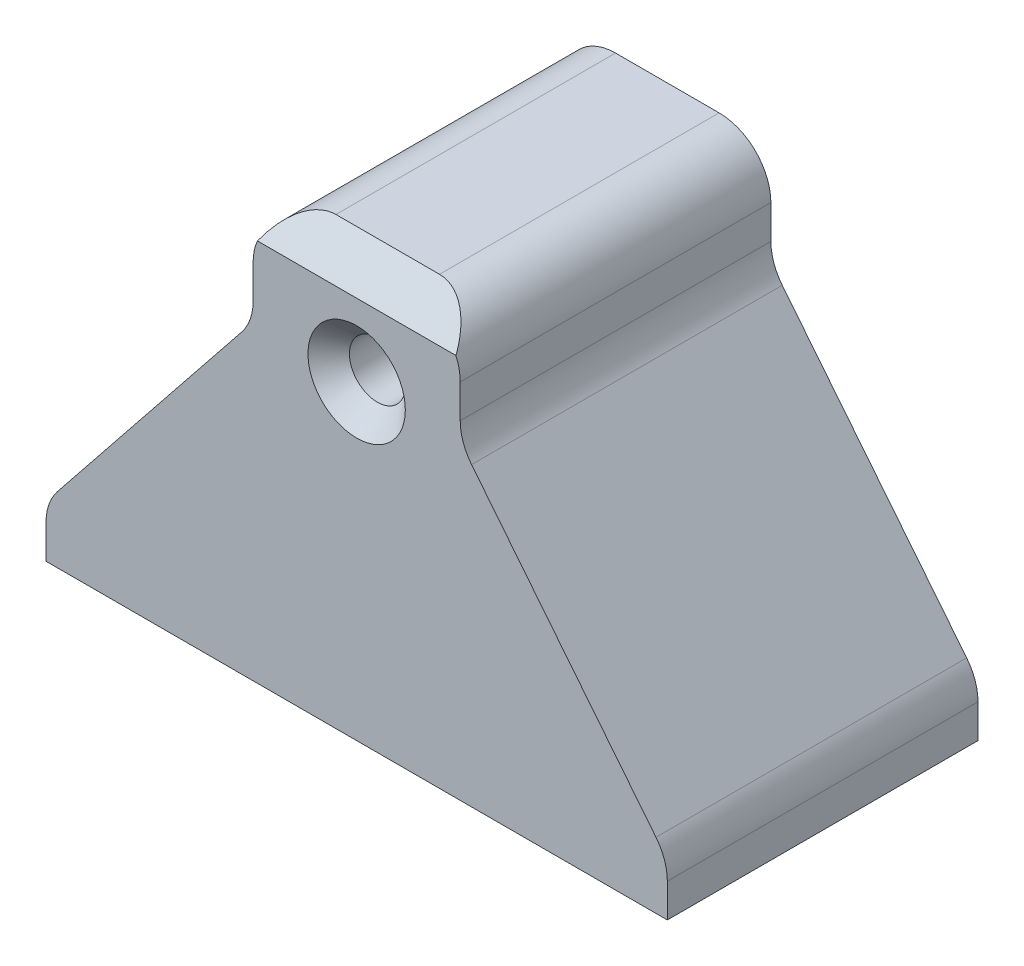
from build123d import *

# Parameters (mm, degrees)
BOSS_EXTRUDE1_DEPTH = 38.1
CUT_EXTRUDE1_DEPTH  = 19.05
CHAMFER1_SIZE       = 2.54
CHAMFER2_SIZE       = 2.54
FILLET1_R           = 6.35
CHAMFER3_SIZE       = 3.81


with BuildPart() as part:
    # Sketch1 → Boss-Extrude1 (new body)
    with BuildSketch(Plane.XY):
        with BuildLine():
            Line((0, 3.429), (0, 12.7))
            Line((0, 12.7), (-12.7, 12.7))
            Line((-12.7, 12.7), (-12.7, 0))
            Line((-12.7, 0), (-38.1, -31.75))
            Line((-38.1, -31.75), (-38.1, -38.1))
            Line((-38.1, -38.1), (0, -38.1))
            Line((0, -38.1), (0, -3.429))
            ThreePointArc((0, -3.429), (-3.429, 0), (0, 3.429))
        make_face()
        with BuildLine():
            Line((12.7, 12.7), (0, 12.7))
            Line((0, 12.7), (0, 3.429))
            ThreePointArc((0, 3.429), (2.424669153, 2.424669153), (3.429, 0))
            ThreePointArc((3.429, 0), (2.424669153, -2.424669153), (0, -3.429))
            Line((0, -3.429), (0, -38.1))
            Line((0, -38.1), (38.1, -38.1))
            Line((38.1, -38.1), (38.1, -31.75))
            Line((38.1, -31.75), (12.7, 0))
            Line((12.7, 0), (12.7, 12.7))
        make_face()
    extrude(amount=BOSS_EXTRUDE1_DEPTH)

    # Sketch2 → Cut-Extrude1 (cut)
    with BuildSketch(Plane(origin=(0, 0, 0), x_dir=(-1, 0, 0), z_dir=(0, 0, -1))):
        Polygon((6.745760545, 0), (3.372880273, 5.842), (-3.372880273, 5.842), (-6.745760545, 0), (-3.372880273, -5.842), (3.372880273, -5.842), align=None)
    extrude(amount=-CUT_EXTRUDE1_DEPTH, mode=Mode.SUBTRACT)

    # Chamfer1
    chamfer1_edges = [part.edges().sort_by_distance(p)[0] for p in [
        (-5.059320409, -2.921, 0),
        (-5.059320409, 2.921, 0),
        (0, 5.842, 0),
        (5.059320409, 2.921, 0),
        (5.059320409, -2.921, 0),
        (0, -5.842, 0),
    ]]
    chamfer(chamfer1_edges, length=CHAMFER1_SIZE)

    # Chamfer2
    chamfer2_edges = [part.edges().sort_by_distance(p)[0] for p in [
        (0, 3.429, 38.1),
    ]]
    chamfer(chamfer2_edges, length=CHAMFER2_SIZE)

    # Fillet1
    fillet1_edges = [part.edges().sort_by_distance(p)[0] for p in [
        (12.7, 0, 19.05),
        (38.1, -31.75, 19.05),
        (-38.1, -31.75, 19.05),
        (-12.7, 0, 19.05),
        (-12.7, 12.7, 19.05),
        (12.7, 12.7, 19.05),
    ]]
    fillet(fillet1_edges, radius=FILLET1_R)

    # Chamfer3
    # the kernel refuses this chamfer: 3.81 mm, written as the material it takes off along each edge
    with BuildSketch(Plane(origin=(-16.148112184, 12.7, 38.1), x_dir=(0, -0.9996219169112968, 0.027495876610586386), z_dir=(1, 0, 0))) as chamfer3_piece_1:
        Polygon((CHAMFER3_SIZE * 0.999621916911, CHAMFER3_SIZE * 0.0274958766106), (-CHAMFER3_SIZE * 0.0274958766106, CHAMFER3_SIZE * 0.999621916911), (0, 0), align=None)
    extrude(amount=32.296224368, mode=Mode.SUBTRACT)


solid = part.part
